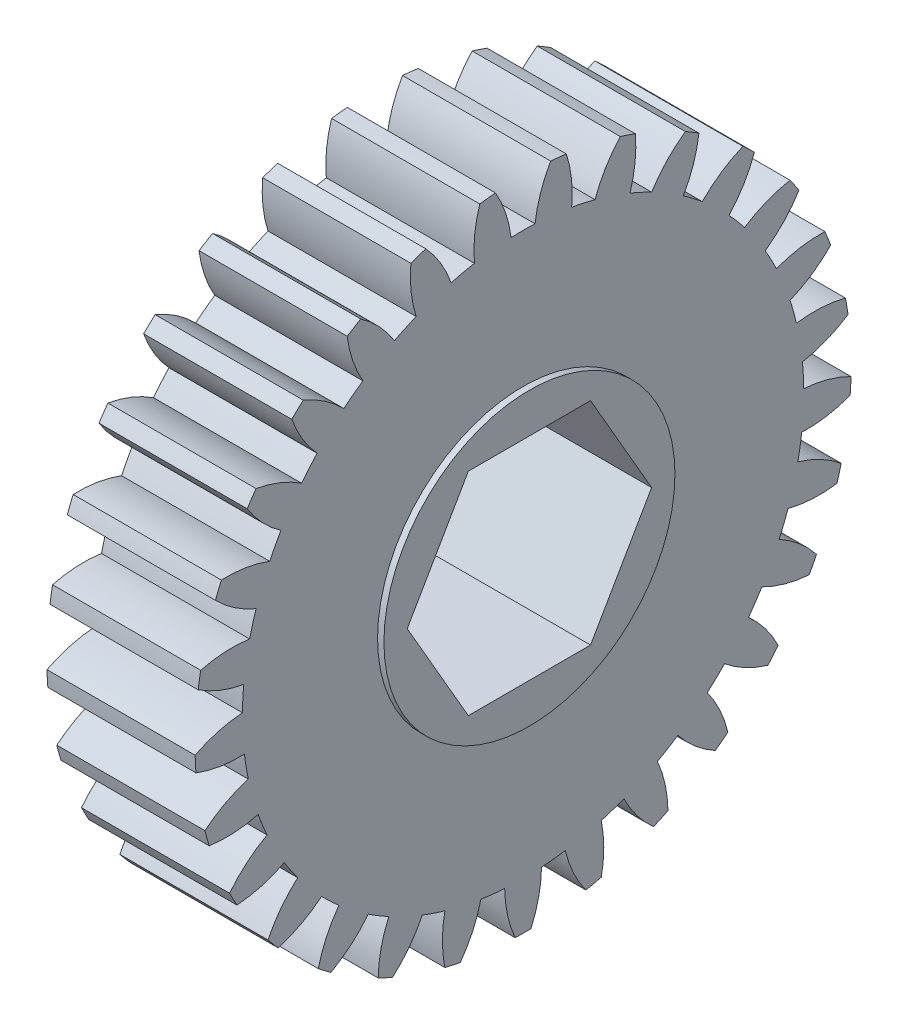
from build123d import *

# Parameters (mm, degrees)
SPUR_START             = -46.469550595
SPUR_GEAR_AI_OUTLINE_R = 6.35
SPUR_GEAR_AI_DEPTH     = 8.89
CUT_EXTRUDE1_DEPTH     = 49.524492692
SKETCH2_R              = 8.73125
BOSS_EXTRUDE1_DEPTH    = 0.381
BOSS_EXTRUDE2_START    = 0.381
SKETCH3_R              = 8.73125
BOSS_EXTRUDE2_DEPTH    = 0.381


# Read off the part's stored shape, not the designer's step: spur gear_ai
with BuildPart() as part:
    # spur gear_ai outline → spur gear_ai (new body)
    with BuildSketch(Plane.YZ.offset(SPUR_START)):
        with BuildLine():
            ThreePointArc((22.804874113, 14.861845519), (22.961783964, 15.309628518), (23.107855844, 15.761063255))
            ThreePointArc((23.107855844, 15.761063255), (21.922741985, 16.646659841), (20.584560278, 17.277568624))
            ThreePointArc((20.584560278, 17.277568624), (20.753716772, 17.974933931), (20.893010588, 18.678872511))
            ThreePointArc((20.893010588, 18.678872511), (22.372423135, 18.6895819), (23.819855698, 18.9957112))
            ThreePointArc((23.819855698, 18.9957112), (23.876836976, 19.466756261), (23.922448653, 19.939037841))
            ThreePointArc((23.922448653, 19.939037841), (22.574665009, 20.549165223), (21.132142507, 20.877654199))
            ThreePointArc((21.132142507, 20.877654199), (21.147431289, 21.595079139), (21.132142507, 22.312504079))
            ThreePointArc((21.132142507, 22.312504079), (22.574665009, 22.640993054), (23.922448653, 23.251120437))
            ThreePointArc((23.922448653, 23.251120437), (23.876836976, 23.723402017), (23.819855698, 24.194447078))
            ThreePointArc((23.819855698, 24.194447078), (22.372423135, 24.500576378), (20.893010588, 24.511285766))
            ThreePointArc((20.893010588, 24.511285766), (20.753716772, 25.215224346), (20.584560278, 25.912589653))
            ThreePointArc((20.584560278, 25.912589653), (21.922741985, 26.543498436), (23.107855844, 27.429095023))
            ThreePointArc((23.107855844, 27.429095023), (22.961783964, 27.88052976), (22.804874113, 28.328312759))
            ThreePointArc((22.804874113, 28.328312759), (21.325472968, 28.31612971), (19.878346062, 28.008558753))
            ThreePointArc((19.878346062, 28.008558753), (19.590982872, 28.666095587), (19.275868235, 29.310793235))
            ThreePointArc((19.275868235, 29.310793235), (20.447137259, 30.214621232), (21.414166727, 31.33427751))
            ThreePointArc((21.414166727, 31.33427751), (21.174464802, 31.743756817), (20.924963307, 32.147339919))
            ThreePointArc((20.924963307, 32.147339919), (19.482768734, 31.817414188), (18.135593516, 31.205944561))
            ThreePointArc((18.135593516, 31.205944561), (17.713597734, 31.786333957), (17.267259366, 32.348218601))
            ThreePointArc((17.267259366, 32.348218601), (18.216848469, 33.482703819), (18.920576322, 34.784065906))
            ThreePointArc((18.920576322, 34.784065906), (18.598452548, 35.132442986), (18.268025822, 35.472955093))
            ThreePointArc((18.268025822, 35.472955093), (16.930473237, 34.84071364), (15.746242121, 33.953936984))
            ThreePointArc((15.746242121, 33.953936984), (15.209345802, 34.43004058), (14.652653988, 34.882839117))
            ThreePointArc((14.652653988, 34.882839117), (15.336161438, 36.194934289), (15.743682144, 37.61715194))
            ThreePointArc((15.743682144, 37.61715194), (15.354198671, 37.888137068), (14.958297101, 38.149656212))
            ThreePointArc((14.958297101, 38.149656212), (13.787928975, 37.244661945), (12.822015293, 36.124042949))
            ThreePointArc((12.822015293, 36.124042949), (12.195323112, 36.47359867), (11.554308142, 36.796138744))
            ThreePointArc((11.554308142, 36.796138744), (11.939773892, 38.224491757), (12.032032236, 39.701063656))
            ThreePointArc((12.032032236, 39.701063656), (11.593400877, 39.881985868), (11.150536381, 40.052283706))
            ThreePointArc((11.150536381, 40.052283706), (10.202077827, 38.916853151), (9.499646629, 37.614790715))
            ThreePointArc((9.499646629, 37.614790715), (8.812462016, 37.821453723), (8.117097038, 37.998653719))
            ThreePointArc((8.117097038, 37.998653719), (8.186497136, 39.476476375), (7.95917922, 40.93835966))
            ThreePointArc((7.95917922, 40.93835966), (7.491909891, 41.020759235), (7.02279032, 41.091872828))
            ThreePointArc((7.02279032, 41.091872828), (6.340590206, 39.779097455), (5.934486394, 38.356474572))
            ThreePointArc((5.934486394, 38.356474572), (5.218941337, 38.410581535), (4.501740845, 38.434155778))
            ThreePointArc((4.501740845, 38.434155778), (4.251830221, 39.892346731), (3.715565178, 41.271185365))
            ThreePointArc((3.715565178, 41.271185365), (3.241506874, 41.25120939), (2.768067737, 41.219813546))
            ThreePointArc((2.768067737, 41.219813546), (2.384024982, 39.791077273), (2.293237519, 38.314414207))
            ThreePointArc((2.293237519, 38.314414207), (1.582790111, 38.213435144), (0.877289602, 38.082281329))
            ThreePointArc((0.877289602, 38.082281329), (0.319753798, 39.452657191), (-0.500383214, 40.683978211))
            ThreePointArc((-0.500383214, 40.683978211), (-0.959064055, 40.562560742), (-1.414685269, 40.430123495))
            ThreePointArc((-1.414685269, 40.430123495), (-1.482613252, 38.952232442), (-1.253839245, 37.490576317))
            ThreePointArc((-1.253839245, 37.490576317), (-1.925969274, 37.239232896), (-2.58678138, 36.959483629))
            ThreePointArc((-2.58678138, 36.959483629), (-3.425872609, 38.177967148), (-4.491532895, 39.204195353))
            ThreePointArc((-4.491532895, 39.204195353), (-4.913388866, 38.987013734), (-5.329887817, 38.759727703))
            ThreePointArc((-5.329887817, 38.759727703), (-5.078524791, 37.301786414), (-4.540886532, 35.923482646))
            ThreePointArc((-4.540886532, 35.923482646), (-5.143271129, 35.533527406), (-5.728495992, 35.118263452))
            ThreePointArc((-5.728495992, 35.118263452), (-6.809907672, 36.127879692), (-8.071262142, 36.901029791))
            ThreePointArc((-8.071262142, 36.901029791), (-8.436567727, 36.598239194), (-8.794469385, 36.286732022))
            ThreePointArc((-8.794469385, 36.286732022), (-8.235568806, 34.91691221), (-7.414205664, 33.686408751))
            ThreePointArc((-7.414205664, 33.686408751), (-7.918677994, 33.176075566), (-8.40095115, 32.644714206))
            ThreePointArc((-8.40095115, 32.644714206), (-9.674117673, 33.398254635), (-11.072186794, 33.882174988))
            ThreePointArc((-11.072186794, 33.882174988), (-11.363860709, 33.507933565), (-11.646429992, 33.12677098))
            ThreePointArc((-11.646429992, 33.12677098), (-10.80612543, 31.909123898), (-9.739443431, 30.883957722))
            ThreePointArc((-9.739443431, 30.883957722), (-10.122414929, 30.277109205), (-10.479185821, 29.654496306))
            ThreePointArc((-10.479185821, 29.654496306), (-11.884575337, 30.11672621), (-13.35398695, 30.28878924))
            ThreePointArc((-13.35398695, 30.28878924), (-13.558390847, 29.860596103), (-13.752415128, 29.427600844))
            ThreePointArc((-13.752415128, 29.427600844), (-12.669998291, 28.419062316), (-11.4078743, 27.647169055))
            ThreePointArc((-11.4078743, 27.647169055), (-11.651437644, 26.972180767), (-11.866024062, 26.287429016))
            ThreePointArc((-11.866024062, 26.287429016), (-13.337922118, 26.436735038), (-14.809968169, 26.288895269))
            ThreePointArc((-14.809968169, 26.288895269), (-14.91754435, 25.826772254), (-15.01395127, 25.362190699))
            ThreePointArc((-15.01395127, 25.362190699), (-13.740034765, 24.609918865), (-12.341484298, 24.127391389))
            ThreePointArc((-12.341484298, 24.127391389), (-12.434250737, 23.415825033), (-12.496618859, 22.70095266))
            ThreePointArc((-12.496618859, 22.70095266), (-13.966201137, 22.530353418), (-15.372050389, 22.069523673))
            ThreePointArc((-15.372050389, 22.069523673), (-15.377768711, 21.595079139), (-15.372050389, 21.120634604))
            ThreePointArc((-15.372050389, 21.120634604), (-13.966201137, 20.659804859), (-12.496618859, 20.489205617))
            ThreePointArc((-12.496618859, 20.489205617), (-12.434250737, 19.774333245), (-12.341484298, 19.062766889))
            ThreePointArc((-12.341484298, 19.062766889), (-13.740034765, 18.580239413), (-15.01395127, 17.827967578))
            ThreePointArc((-15.01395127, 17.827967578), (-14.91754435, 17.363386023), (-14.809968169, 16.901263008))
            ThreePointArc((-14.809968169, 16.901263008), (-13.337922118, 16.753423239), (-11.866024062, 16.902729262))
            ThreePointArc((-11.866024062, 16.902729262), (-11.651437644, 16.217977511), (-11.4078743, 15.542989223))
            ThreePointArc((-11.4078743, 15.542989223), (-12.669998291, 14.771095962), (-13.752415128, 13.762557433))
            ThreePointArc((-13.752415128, 13.762557433), (-13.558390847, 13.329562175), (-13.35398695, 12.901369038))
            ThreePointArc((-13.35398695, 12.901369038), (-11.884575337, 13.073432068), (-10.479185821, 13.535661972))
            ThreePointArc((-10.479185821, 13.535661972), (-10.122414929, 12.913049073), (-9.739443431, 12.306200555))
            ThreePointArc((-9.739443431, 12.306200555), (-10.80612543, 11.28103438), (-11.646429992, 10.063387297))
            ThreePointArc((-11.646429992, 10.063387297), (-11.363860709, 9.682224713), (-11.072186794, 9.307983289))
            ThreePointArc((-11.072186794, 9.307983289), (-9.674117674, 9.791903643), (-8.40095115, 10.545444071))
            ThreePointArc((-8.40095115, 10.545444071), (-7.918677994, 10.014082712), (-7.414205664, 9.503749527))
            ThreePointArc((-7.414205664, 9.503749527), (-8.235568806, 8.273246068), (-8.794469385, 6.903426256))
            ThreePointArc((-8.794469385, 6.903426256), (-8.436567727, 6.591919084), (-8.071262142, 6.289128487))
            ThreePointArc((-8.071262142, 6.289128487), (-6.809907672, 7.062278585), (-5.728495992, 8.071894825))
            ThreePointArc((-5.728495992, 8.071894825), (-5.143271129, 7.656630872), (-4.540886532, 7.266675632))
            ThreePointArc((-4.540886532, 7.266675632), (-5.078524791, 5.888371864), (-5.329887817, 4.430430574))
            ThreePointArc((-5.329887817, 4.430430574), (-4.913388866, 4.203144544), (-4.491532895, 3.985962925))
            ThreePointArc((-4.491532895, 3.985962925), (-3.425872609, 5.01219113), (-2.58678138, 6.230674648))
            ThreePointArc((-2.58678138, 6.230674648), (-1.925969274, 5.950925382), (-1.253839245, 5.69958196))
            ThreePointArc((-1.253839245, 5.69958196), (-1.482613252, 4.237925835), (-1.414685269, 2.760034783))
            ThreePointArc((-1.414685269, 2.760034783), (-0.959064055, 2.627597536), (-0.500383214, 2.506180067))
            ThreePointArc((-0.500383214, 2.506180067), (0.319753798, 3.737501087), (0.877289602, 5.107876949))
            ThreePointArc((0.877289602, 5.107876949), (1.582790111, 4.976723134), (2.293237519, 4.87574407))
            ThreePointArc((2.293237519, 4.87574407), (2.384024982, 3.399081004), (2.768067737, 1.970344731))
            ThreePointArc((2.768067737, 1.970344731), (3.241506874, 1.938948887), (3.715565178, 1.918972913))
            ThreePointArc((3.715565178, 1.918972913), (4.251830221, 3.297811547), (4.501740845, 4.756002499))
            ThreePointArc((4.501740845, 4.756002499), (5.218941337, 4.779576743), (5.934486394, 4.833683706))
            ThreePointArc((5.934486394, 4.833683706), (6.340590206, 3.411060823), (7.02279032, 2.09828545))
            ThreePointArc((7.02279032, 2.09828545), (7.491909891, 2.169399043), (7.95917922, 2.251798618))
            ThreePointArc((7.95917922, 2.251798618), (8.186497136, 3.713681903), (8.117097038, 5.191504558))
            ThreePointArc((8.117097038, 5.191504558), (8.812462016, 5.368704555), (9.499646629, 5.575367563))
            ThreePointArc((9.499646629, 5.575367563), (10.202077827, 4.273305127), (11.150536381, 3.137874572))
            ThreePointArc((11.150536381, 3.137874572), (11.593400878, 3.308172409), (12.032032236, 3.489094622))
            ThreePointArc((12.032032236, 3.489094622), (11.939773892, 4.96566652), (11.554308142, 6.394019533))
            ThreePointArc((11.554308142, 6.394019533), (12.195323112, 6.716559608), (12.822015293, 7.066115328))
            ThreePointArc((12.822015293, 7.066115328), (13.787928975, 5.945496333), (14.958297101, 5.040502066))
            ThreePointArc((14.958297101, 5.040502066), (15.354198671, 5.30202121), (15.743682144, 5.573006338))
            ThreePointArc((15.743682144, 5.573006338), (15.336161438, 6.995223989), (14.652653988, 8.307319161))
            ThreePointArc((14.652653988, 8.307319161), (15.209345802, 8.760117698), (15.746242121, 9.236221294))
            ThreePointArc((15.746242121, 9.236221294), (16.930473236, 8.349444637), (18.268025822, 7.717203185))
            ThreePointArc((18.268025822, 7.717203185), (18.598452548, 8.057715291), (18.920576322, 8.406092371))
            ThreePointArc((18.920576322, 8.406092371), (18.216848469, 9.707454459), (17.267259366, 10.841939677))
            ThreePointArc((17.267259366, 10.841939677), (17.713597734, 11.40382432), (18.135593516, 11.984213717))
            ThreePointArc((18.135593516, 11.984213717), (19.482768734, 11.372744089), (20.924963307, 11.042818359))
            ThreePointArc((20.924963307, 11.042818359), (21.174464802, 11.44640146), (21.414166727, 11.855880767))
            ThreePointArc((21.414166727, 11.855880767), (20.447137259, 12.975537046), (19.275868235, 13.879365043))
            ThreePointArc((19.275868235, 13.879365043), (19.590982872, 14.524062691), (19.878346062, 15.181599525))
            ThreePointArc((19.878346062, 15.181599525), (21.325472968, 14.874028567), (22.804874113, 14.861845519))
        make_face()
        with Locations((4.307231289, 21.595079139)):
            Circle(SPUR_GEAR_AI_OUTLINE_R, mode=Mode.SUBTRACT)
    extrude(amount=SPUR_GEAR_AI_DEPTH)

    # Sketch1 → Cut-Extrude1 (cut, through all)
    with BuildSketch(Plane(origin=(-37.579550595, 0, 0), x_dir=(0, 0, -1), z_dir=(1, 0, 0))):
        Polygon((-17.928904929, 10.657231289), (-25.261253348, 10.657231289), (-28.927427557, 4.307231289), (-25.261253348, -2.042768711), (-17.928904929, -2.042768711), (-14.26273072, 4.307231289), align=None)
    extrude(amount=-CUT_EXTRUDE1_DEPTH, mode=Mode.SUBTRACT)

    # Sketch2 → Boss-Extrude1 (add)
    with BuildSketch(Plane(origin=(-37.579550595, 0, 0), x_dir=(0, 0, -1), z_dir=(1, 0, 0))):
        with Locations(Location((-21.595079139, 4.307231289, 0), (0, 0, 180))):
            Circle(SKETCH2_R)
        Polygon((-17.928904929, 10.657231289), (-25.261253348, 10.657231289), (-28.927427557, 4.307231289), (-25.261253348, -2.042768711), (-17.928904929, -2.042768711), (-14.26273072, 4.307231289), align=None, mode=Mode.SUBTRACT)
    extrude(amount=BOSS_EXTRUDE1_DEPTH)

    # Sketch3 → Boss-Extrude2 (add)
    with BuildSketch(Plane.ZY.offset(46.469550595).offset(BOSS_EXTRUDE2_START)):
        with Locations((21.595079139, 4.307231289)):
            Circle(SKETCH3_R)
        Polygon((25.261253348, 10.657231289), (17.928904929, 10.657231289), (14.26273072, 4.307231289), (17.928904929, -2.042768711), (25.261253348, -2.042768711), (28.927427557, 4.307231289), align=None, mode=Mode.SUBTRACT)
    extrude(amount=-BOSS_EXTRUDE2_DEPTH)


solid = part.part
